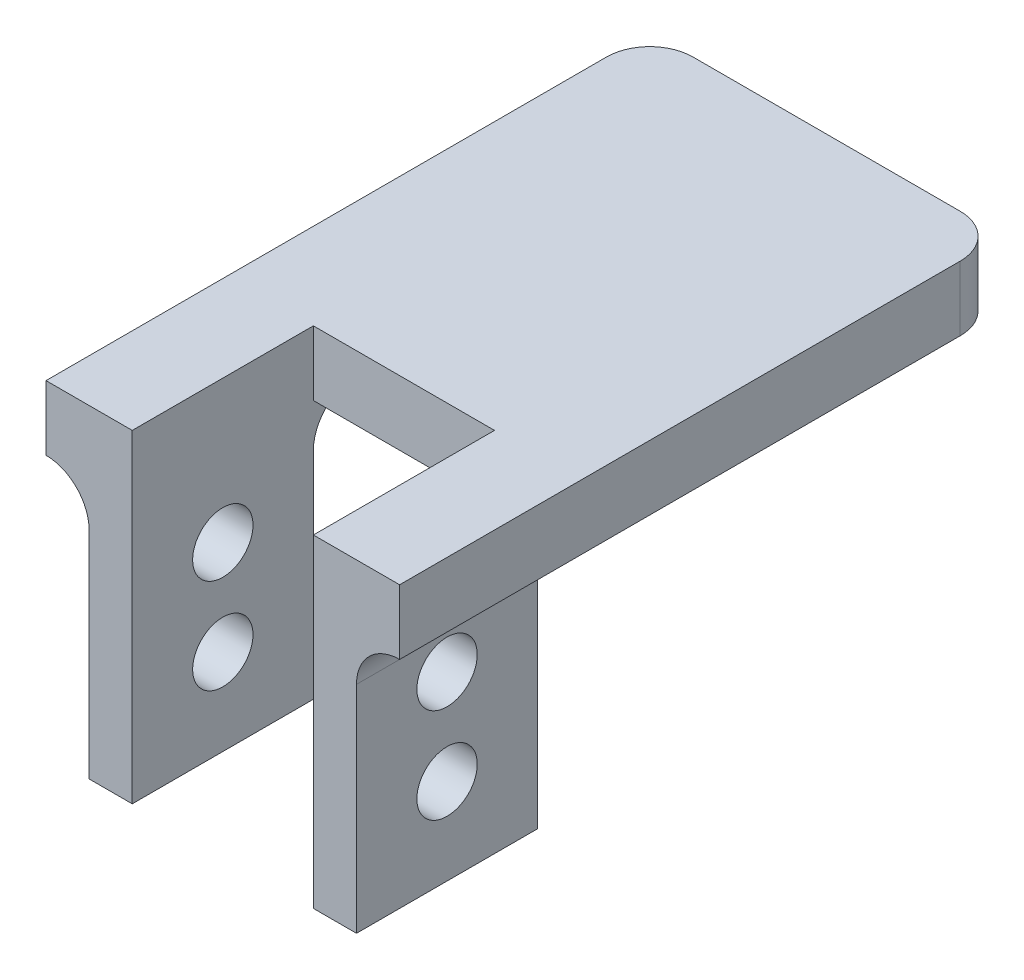
from build123d import *

# Parameters (mm, degrees)
BOSS_EXTRUDE1_DEPTH = 7.5
SKETCH2_W           = 5
SKETCH2_H           = 21
BOSS_EXTRUDE2_DEPTH = 30
SKETCH3_R           = 3.5
CUT_EXTRUDE1_DEPTH  = 79.238417673
FILLET1_R           = 5


with BuildPart() as part:
    # Sketch1 → Boss-Extrude1 (new body)
    with BuildSketch(Plane(origin=(0, 0, 0), x_dir=(1, 0, 0), z_dir=(0, 1, 0))):
        Polygon((-20.5, -10.5), (-10.5, -10.5), (-10.5, 10.5), (10.5, 10.5), (10.5, -10.5), (20.5, -10.5), (20.5, 59.5), (-20.5, 59.5), align=None)
    extrude(amount=BOSS_EXTRUDE1_DEPTH)

    # Sketch2 → Boss-Extrude2 (add)
    with BuildSketch(Plane.XZ):
        with Locations((-13, 0)):
            Rectangle(SKETCH2_W, SKETCH2_H)
        with Locations((13, 0)):
            Rectangle(SKETCH2_W, SKETCH2_H)
    extrude(amount=BOSS_EXTRUDE2_DEPTH)

    # Sketch3 → Cut-Extrude1 (cut, through all)
    with BuildSketch(Plane(origin=(20.5, 0, 0), x_dir=(0, 0, -1), z_dir=(1, 0, 0))):
        with Locations((0, -9)):
            Circle(SKETCH3_R)
        with Locations((0, -20)):
            Circle(SKETCH3_R)
    extrude(amount=-CUT_EXTRUDE1_DEPTH, mode=Mode.SUBTRACT)

    # Fillet1
    fillet1_edges = [part.edges().sort_by_distance(p)[0] for p in [
        (-13, 0, -10.5),
        (13, 0, -10.5),
        (-15.5, 0, 0),
        (15.5, 0, 0),
    ]]
    fillet(fillet1_edges, radius=FILLET1_R - 0.0001)  # a hair under: the kernel refuses the full size
    fillet1_2_edges = [part.edges().sort_by_distance(p)[0] for p in [
        (-20.5, 3.75, -59.5),
        (20.5, 3.75, -59.5),
    ]]
    fillet(fillet1_2_edges, radius=FILLET1_R)


solid = part.part
